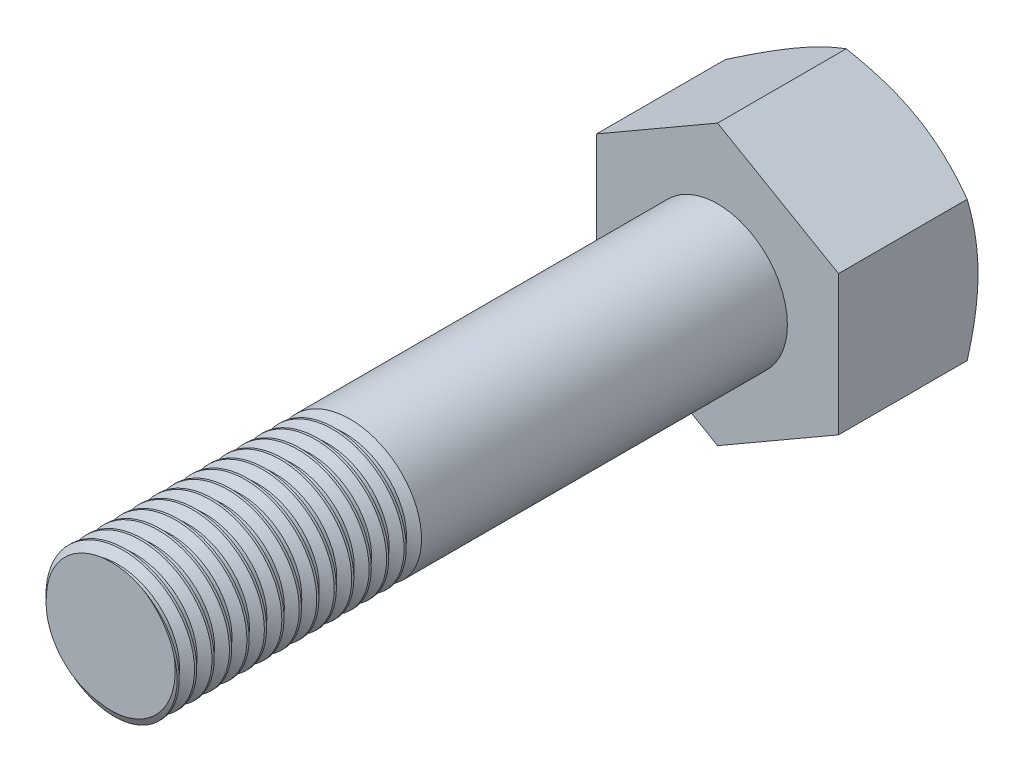
from build123d import *

# Parameters (mm, degrees)
BOSS_EXTRUDE2_DEPTH = 24
SKETCH3_R           = 12
BOSS_EXTRUDE3_DEPTH = 105
SKETCH5_OUTSIDE_W   = 190.106
SKETCH5_OUTSIDE_H   = 196.536
SKETCH5_OUTSIDE_R   = 20.720180512
CUT_EXTRUDE1_DEPTH  = 34
CUT_EXTRUDE1_DRAFT  = -60
THREAD1_PITCH       = 3


with BuildPart() as part:
    # Sketch1 → Boss-Extrude2 (new body)
    with BuildSketch(Plane.XY):
        Polygon((0, 24), (-20.784609691, 12), (-20.784609691, -12), (0, -24), (20.784609691, -12), (20.784609691, 12), align=None)
    extrude(amount=BOSS_EXTRUDE2_DEPTH)

    # Sketch3 → Boss-Extrude3 (add)
    with BuildSketch(Plane.XY.offset(24)):
        Circle(SKETCH3_R)
    extrude(amount=BOSS_EXTRUDE3_DEPTH)


with BuildPart() as cut_extrude1_tool:
    # Sketch5 outside → Cut-Extrude1 (with draft: the straight prism first)
    with BuildSketch(Plane(origin=(0, 0, 0), x_dir=(-1, 0, 0), z_dir=(0, 0, -1))):
        Rectangle(SKETCH5_OUTSIDE_W, SKETCH5_OUTSIDE_H)
        Circle(SKETCH5_OUTSIDE_R, mode=Mode.SUBTRACT)
    extrude(amount=-CUT_EXTRUDE1_DEPTH)
    # Cut-Extrude1: the draft: its side faces are tilted about the plane it starts from
    cut_extrude1_sides = [cut_extrude1_tool.faces().sort_by_distance(p)[0] for p in [
        (0, -98.268, 17),
        (-95.053, 0, 17),
        (0, 98.268, 17),
        (95.053, 0, 17),
        (20.720180512, 0, 17),
    ]]
    draft(cut_extrude1_sides, Plane(origin=(0, 0, 0), x_dir=(-1, 0, 0), z_dir=(0, 0, -1)), CUT_EXTRUDE1_DRAFT)


with BuildPart() as part_1:
    add(part.part)

    # Cut-Extrude1: cut by cut_extrude1_tool
    add(cut_extrude1_tool.part, mode=Mode.SUBTRACT)

    # Thread1: the profile of Thread Profile1 profile screwed along a right-hand helix of 16.666667 turns, 10 arcs to a turn; built about Z, then put on its axis
    thread1_z = Axis((0, 0, 0), (0, 0, 1))
    thread1_corners = [(12.0003, 0, -0.000173205), (12.0003, 0, 2.625173197), (10.376202375, 0, 1.687499996), (10.376202375, 0, 0.937499996)]
    with BuildLine(mode=Mode.PRIVATE) as thread1_profile:
        Line(thread1_corners[0], thread1_corners[1])
        Line(thread1_corners[1], thread1_corners[2])
        Line(thread1_corners[2], thread1_corners[3])
        Line(thread1_corners[3], thread1_corners[0])
    thread1_cap = Face(thread1_profile.wire())
    thread1_turn_angles = [0, 18, 36, 54, 72, 90, 108, 126, 144, 162, 180, 198, 216, 234, 252, 270, 288, 306, 324, 342, 360]
    thread1_turn_weights = [1, 0.9510565162951535, 1, 0.9510565162951535, 1, 0.9510565162951535, 1, 0.9510565162951535, 1, 0.9510565162951535, 1, 0.9510565162951535, 1, 0.9510565162951535, 1, 0.9510565162951535, 1, 0.9510565162951535, 1, 0.9510565162951535, 1]
    thread1_turn_rails = [Edge.make_bspline([Vector(p[0], p[1], 0).rotate(thread1_z, thread1_turn_angles[k]) / thread1_turn_weights[k] + Vector(0, 0, p[2] + THREAD1_PITCH * thread1_turn_angles[k] / 360) for k in range(21)], [0, 0, 0, 1, 1, 2, 2, 3, 3, 4, 4, 5, 5, 6, 6, 7, 7, 8, 8, 9, 9, 10, 10, 10], 2, thread1_turn_weights) for p in thread1_corners]
    thread1_turn_sides = [Face.make_surface_from_curves(thread1_turn_rails[p[0]], thread1_turn_rails[p[1]]) for p in [(0, 1), (1, 2), (2, 3), (3, 0)]]
    thread1_last_angles = [5760, 5778, 5796, 5814, 5832, 5850, 5868, 5886, 5904, 5922, 5940, 5958, 5976, 5988, 6000]
    thread1_last_weights = [1, 0.9510565162951535, 1, 0.9510565162951535, 1, 0.9510565162951535, 1, 0.9510565162951535, 1, 0.9510565162951535, 1, 0.9510565162951535, 1, 0.9781476007338089, 1]
    thread1_last_rails = [Edge.make_bspline([Vector(p[0], p[1], 0).rotate(thread1_z, thread1_last_angles[k]) / thread1_last_weights[k] + Vector(0, 0, p[2] + THREAD1_PITCH * thread1_last_angles[k] / 360) for k in range(15)], [0, 0, 0, 1, 1, 2, 2, 3, 3, 4, 4, 5, 5, 6, 6, 7, 7, 7], 2, thread1_last_weights) for p in thread1_corners]
    thread1_last_sides = [Face.make_surface_from_curves(thread1_last_rails[p[0]], thread1_last_rails[p[1]]) for p in [(0, 1), (1, 2), (2, 3), (3, 0)]]
    thread1 = Plane(origin=(0, 0, 139), x_dir=(-1, 0, 0), z_dir=(0, 0, -1)) * Solid(Shell([*[p.moved(Location((0, 0, THREAD1_PITCH * i))) for i in range(16) for p in thread1_turn_sides], *thread1_last_sides, thread1_cap, thread1_cap.rotate(thread1_z, 6000).moved(Location((0, 0, THREAD1_PITCH * 6000 / 360)))]))
    add(thread1, mode=Mode.SUBTRACT)


solid = part_1.part
